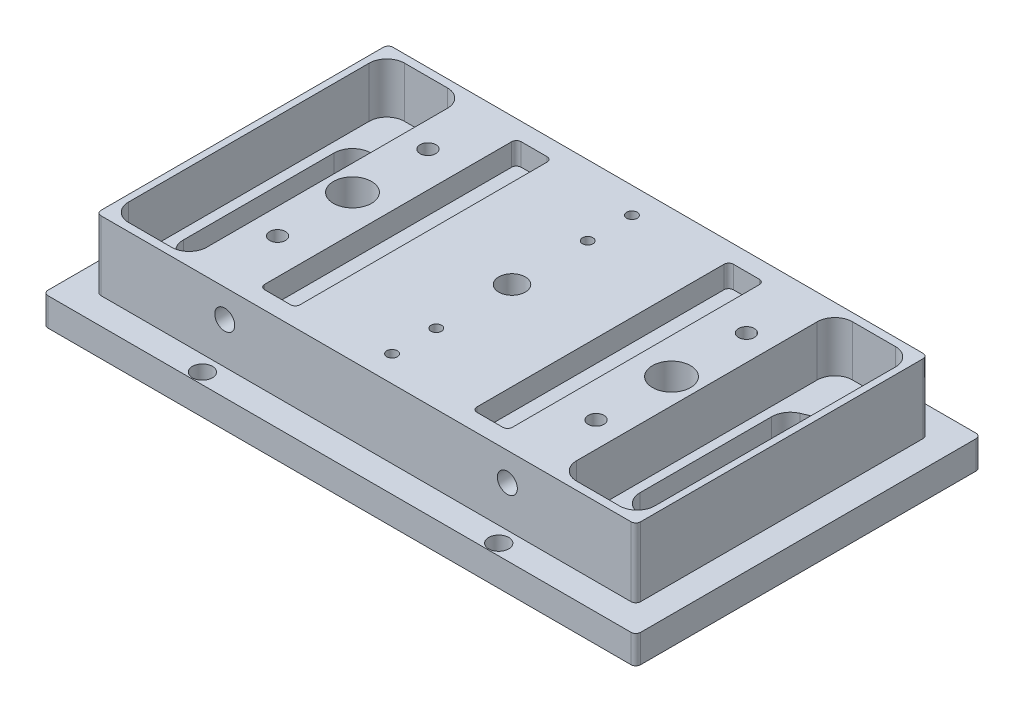
from build123d import *

# Parameters (mm, degrees)
MAIN_SKETCH_W                         = 67
MAIN_SKETCH_H                         = 39
MAIN_SKETCH_W_2                       = 61
MAIN_SKETCH_H_2                       = 33
LIP_DEPTH                             = 3.175
MOUNTING_BASE_OUTLINE_W               = 61
MOUNTING_BASE_OUTLINE_H               = 33
MOUNTING_BASE_OUTLINE_R               = 2.15265
MOUNTING_BASE_OUTLINE_R_2             = 1.5
MOUNTING_BASE_DEPTH                   = 11
HEATER_CART_4_40_TAPS_D               = 2.2606
HEATER_CART_4_40_TAPS_DEPTH           = 7.595
HEATER_CART_4_40_TAPS_TIP             = 0.679152758
HEATER_CART_4_40_TAPS_ON_FACE_2_D     = 2.2606
HEATER_CART_4_40_TAPS_ON_FACE_2_DEPTH = 7.595
HEATER_CART_4_40_TAPS_ON_FACE_2_TIP   = 0.679152758
CHIP_CLAMP_0_80_TAPS_AT_2_COUNT       = 2
CHIP_CLAMP_0_80_TAPS_AT_2_PITCH       = 5
CHIP_CLAMP_0_80_TAPS_AT_3_COUNT       = 2
CHIP_CLAMP_0_80_TAPS_AT_3_PITCH       = 22.1232
CHIP_CLAMP_0_80_TAPS_AT_4_COUNT       = 2
CHIP_CLAMP_0_80_TAPS_AT_4_PITCH       = 5
CHIP_CLAMP_0_80_TAPS_AT_5_COUNT       = 2
CHIP_CLAMP_0_80_TAPS_AT_5_PITCH       = 22.1232
CHIP_CLAMP_0_80_TAPS_AT_6_COUNT       = 2
CHIP_CLAMP_0_80_TAPS_AT_6_PITCH       = 27.1232
F_2_56_CLOSE_CLEAR_43_0_089_D         = 2.2606
PCB_2_56_TAPS_D                       = 1.778
PCB_2_56_TAPS_DEPTH                   = 5.734
PCB_2_56_TAPS_TIP                     = 0.53416509
MAIN_SKETCH_12_W                      = 8.85
MAIN_SKETCH_12_H                      = 31.2
BOTTOM_SQUARE_CUTOUT_DEPTH            = 2
SQUARE_MICRO_D_CUTOUT_START           = 5.3
SQUARE_MICRO_D_CUTOUT_OUTLINE_W       = 8.85
SQUARE_MICRO_D_CUTOUT_OUTLINE_H       = 31.2
SQUARE_MICRO_D_CUTOUT_DEPTH           = 5.7
MAIN_SKETCH_7_R                       = 0.285
ROUND_MICRO_D_CUTOUT_DEPTH            = 11
INTERNAL_CORNER_CUTOUTS_FILLET_R      = 2
BOTTOM_COVER_2_56_TAPS_D              = 1.778
BOTTOM_COVER_2_56_TAPS_DEPTH          = 5.734
BOTTOM_COVER_2_56_TAPS_TIP            = 0.53416509
F_2_56_TAPPED_HOLE1_D                 = 1.778
F_2_56_TAPPED_HOLE1_DEPTH             = 5.734
F_2_56_TAPPED_HOLE1_TIP               = 0.53416509
SKETCH20_W                            = 5.25
SKETCH20_H                            = 31
SKETCH20_W_2                          = 6
SKETCH20_H_2                          = 8.25
CUT_EXTRUDE3_DEPTH                    = 4
SKETCH23_W                            = 4
SKETCH23_H                            = 29
CUT_EXTRUDE4_DEPTH                    = 2.5
CUT_EXTRUDE7_START                    = -4
SKETCH20_3_W                          = 5.25
SKETCH20_3_H                          = 31
CUT_EXTRUDE7_DEPTH                    = 4
FILLET1_R                             = 0.54


# Read off the part's stored shape, not the designer's step: Mounting_Base, Square_Micro_D_Cutout
with BuildPart() as part:
    # Main_Sketch → Lip (new body)
    with BuildSketch(Plane(origin=(0, 0, 0), x_dir=(1, 0, 0), z_dir=(0, 1, 0))):
        with Locations((33.5, -19.5)):
            Rectangle(MAIN_SKETCH_W, MAIN_SKETCH_H)
        with Locations((33.5, -19.5)):
            Rectangle(MAIN_SKETCH_W_2, MAIN_SKETCH_H_2, mode=Mode.SUBTRACT)
    extrude(amount=LIP_DEPTH)

    # Mounting_Base outline → Mounting_Base (add)
    with BuildSketch(Plane(origin=(0, 0, 0), x_dir=(1, 0, 0), z_dir=(0, 1, 0))):
        with Locations((33.5, -19.5)):
            Rectangle(MOUNTING_BASE_OUTLINE_W, MOUNTING_BASE_OUTLINE_H)
        with Locations((15.466, -19.5)):
            Circle(MOUNTING_BASE_OUTLINE_R, mode=Mode.SUBTRACT)
        with Locations((33.5, -19.5)):
            Circle(MOUNTING_BASE_OUTLINE_R_2, mode=Mode.SUBTRACT)
        with Locations((51.534, -19.5)):
            Circle(MOUNTING_BASE_OUTLINE_R, mode=Mode.SUBTRACT)
    extrude(amount=MOUNTING_BASE_DEPTH)

    # Heater_Cart_#4-40_Taps
    with Locations(Plane(origin=(49.475, 7.825, 3), x_dir=(-1, 0, 0), z_dir=(0, 0, -1))):
        with Locations((0, 0), (31.95, 0)):
            Hole(HEATER_CART_4_40_TAPS_D / 2, depth=HEATER_CART_4_40_TAPS_DEPTH)
            with Locations((0, 0, -(HEATER_CART_4_40_TAPS_DEPTH + HEATER_CART_4_40_TAPS_TIP / 2))):  # 118° drill point
                Cone(0, HEATER_CART_4_40_TAPS_D / 2, HEATER_CART_4_40_TAPS_TIP, mode=Mode.SUBTRACT)

    # Heater_Cart_#4-40_Taps on face 2
    with Locations(Plane(origin=(17.525, 7.825, 36), x_dir=(1, 0, 0), z_dir=(0, 0, 1))):
        with Locations((0, 0), (31.95, 0)):
            Hole(HEATER_CART_4_40_TAPS_ON_FACE_2_D / 2, depth=HEATER_CART_4_40_TAPS_ON_FACE_2_DEPTH)
            with Locations((0, 0, -(HEATER_CART_4_40_TAPS_ON_FACE_2_DEPTH + HEATER_CART_4_40_TAPS_ON_FACE_2_TIP / 2))):  # 118° drill point
                Cone(0, HEATER_CART_4_40_TAPS_ON_FACE_2_D / 2, HEATER_CART_4_40_TAPS_ON_FACE_2_TIP, mode=Mode.SUBTRACT)

    # Sketch3 → Chip_Clamp_#0-80 Taps (revolve, cut)
    with BuildSketch(Plane(origin=(33.5, 11, 5.9384), x_dir=(0, 0, 1), z_dir=(1, 0, 0))):
        Polygon((0, 0), (0, 4.358890611), (0.59563, 4.001), (0.59563, 0), align=None)
    chip_clamp_0_80_taps = revolve(axis=Axis((33.5, 17.35, 5.9384), (0, -1, 0)), mode=Mode.SUBTRACT)

    # Chip_Clamp_#0-80 Taps at 2: Chip_Clamp_#0-80 Taps ×2
    with Locations(*[(0, 0, i * CHIP_CLAMP_0_80_TAPS_AT_2_PITCH) for i in range(1, CHIP_CLAMP_0_80_TAPS_AT_2_COUNT)]):
        add(chip_clamp_0_80_taps, mode=Mode.SUBTRACT)

    # Chip_Clamp_#0-80 Taps at 3: Chip_Clamp_#0-80 Taps ×2
    with Locations(*[(0, 0, i * CHIP_CLAMP_0_80_TAPS_AT_3_PITCH) for i in range(1, CHIP_CLAMP_0_80_TAPS_AT_3_COUNT)]):
        add(chip_clamp_0_80_taps, mode=Mode.SUBTRACT)

    # Chip_Clamp_#0-80 Taps at 4: Chip_Clamp_#0-80 Taps ×2
    with Locations(*[(0, 0, i * CHIP_CLAMP_0_80_TAPS_AT_4_PITCH) for i in range(1, CHIP_CLAMP_0_80_TAPS_AT_4_COUNT)]):
        add(chip_clamp_0_80_taps, mode=Mode.SUBTRACT)

    # Chip_Clamp_#0-80 Taps at 5: Chip_Clamp_#0-80 Taps ×2
    with Locations(*[(0, 0, i * CHIP_CLAMP_0_80_TAPS_AT_5_PITCH) for i in range(1, CHIP_CLAMP_0_80_TAPS_AT_5_COUNT)]):
        add(chip_clamp_0_80_taps, mode=Mode.SUBTRACT)

    # Chip_Clamp_#0-80 Taps at 6: Chip_Clamp_#0-80 Taps ×2
    with Locations(*[(0, 0, i * CHIP_CLAMP_0_80_TAPS_AT_6_PITCH) for i in range(1, CHIP_CLAMP_0_80_TAPS_AT_6_COUNT)]):
        add(chip_clamp_0_80_taps, mode=Mode.SUBTRACT)

    # 2-56_Close_Clear#43 (0.089) (through all)
    with Locations(Plane(origin=(16.75, 0, 37.75), x_dir=(0, 0, -1), z_dir=(0, -1, 0))):
        with Locations((0, 0), (36.5, 0), (36.5, 33.5), (0, 33.5)):
            Hole(F_2_56_CLOSE_CLEAR_43_0_089_D / 2)

    # PCB #2-56 Taps
    with Locations(Plane(origin=(15.5, 11, 11), x_dir=(0, 0, 1), z_dir=(0, 1, 0))):
        with Locations((0, 0), (17, 0), (0, 36), (17, 36)):
            Hole(PCB_2_56_TAPS_D / 2, depth=PCB_2_56_TAPS_DEPTH)
            with Locations((0, 0, -(PCB_2_56_TAPS_DEPTH + PCB_2_56_TAPS_TIP / 2))):  # 118° drill point
                Cone(0, PCB_2_56_TAPS_D / 2, PCB_2_56_TAPS_TIP, mode=Mode.SUBTRACT)

    # Main_Sketch<12> → Bottom_square_cutout (cut)
    with BuildSketch(Plane(origin=(0, 0, 0), x_dir=(1, 0, 0), z_dir=(0, 1, 0))):
        with Locations((8.175, -19.5)):
            Rectangle(MAIN_SKETCH_12_W, MAIN_SKETCH_12_H)
        with BuildLine():
            ThreePointArc((7.771574965, -29.946222286), (6.746212222, -30.101578951), (5.771946869, -29.746175702))
            ThreePointArc((5.771946869, -29.746175702), (5.101632057, -28.994424217), (4.859546604, -28.01675))
            Line((4.859546604, -28.01675), (4.859546604, -10.98325))
            ThreePointArc((4.859546604, -10.98325), (5.101632057, -10.005575783), (5.771946869, -9.253824298))
            ThreePointArc((5.771946869, -9.253824298), (6.746212222, -8.898421049), (7.771574965, -9.053777714))
            Line((7.771574965, -9.053777714), (10.304010046, -10.12581902))
            ThreePointArc((10.304010046, -10.12581902), (11.233840891, -10.898001292), (11.5824534, -12.055291306))
            Line((11.5824534, -12.055291306), (11.5824534, -26.944708694))
            ThreePointArc((11.5824534, -26.944708694), (11.233840891, -28.101998708), (10.304010046, -28.87418098))
            Line((10.304010046, -28.87418098), (7.771574965, -29.946222286))
        make_face(mode=Mode.SUBTRACT)
    bottom_square_cutout = extrude(amount=BOTTOM_SQUARE_CUTOUT_DEPTH, mode=Mode.SUBTRACT)

    # Square_Micro_D_Cutout outline → Square_Micro_D_Cutout (cut)
    with BuildSketch(Plane(origin=(0, 0, 0), x_dir=(1, 0, 0), z_dir=(0, 1, 0)).offset(SQUARE_MICRO_D_CUTOUT_START)):
        with Locations((8.175, -19.5)):
            Rectangle(SQUARE_MICRO_D_CUTOUT_OUTLINE_W, SQUARE_MICRO_D_CUTOUT_OUTLINE_H)
        with BuildLine():
            ThreePointArc((7.771574965, -29.946222286), (5.797492447, -29.763373348), (4.859546604, -28.01675))
            Line((4.859546604, -28.01675), (4.859546604, -10.98325))
            ThreePointArc((4.859546604, -10.98325), (5.797492447, -9.236626652), (7.771574965, -9.053777714))
            Line((7.771574965, -9.053777714), (10.304010046, -10.12581902))
            ThreePointArc((10.304010046, -10.12581902), (11.233840891, -10.898001291), (11.5824534, -12.055291306))
            Line((11.5824534, -12.055291306), (11.5824534, -26.944708694))
            ThreePointArc((11.5824534, -26.944708694), (11.233840891, -28.101998709), (10.304010046, -28.87418098))
            Line((10.304010046, -28.87418098), (7.771574965, -29.946222286))
        make_face(mode=Mode.SUBTRACT)
    square_micro_d_cutout = extrude(amount=SQUARE_MICRO_D_CUTOUT_DEPTH, mode=Mode.SUBTRACT)

    # Main_Sketch<7> → Round_Micro_D_Cutout (cut)
    # profile 1 of 2: a face of its own
    with BuildSketch(Plane(origin=(0, 0, 0), x_dir=(1, 0, 0), z_dir=(0, 1, 0))):
        with BuildLine():
            ThreePointArc((5.771946869, -29.746175702), (5.101632057, -28.994424217), (4.859546604, -28.01675))
            Line((4.859546604, -28.01675), (4.859546604, -10.98325))
            ThreePointArc((4.859546604, -10.98325), (5.101632057, -10.005575783), (5.771946869, -9.253824298))
            ThreePointArc((5.771946869, -9.253824298), (6.746212222, -8.898421049), (7.771574965, -9.053777714))
            Line((7.771574965, -9.053777714), (10.304010046, -10.12581902))
            ThreePointArc((10.304010046, -10.12581902), (11.233840891, -10.898001292), (11.5824534, -12.055291306))
            Line((11.5824534, -12.055291306), (11.5824534, -26.944708694))
            ThreePointArc((11.5824534, -26.944708694), (11.233840891, -28.101998708), (10.304010046, -28.87418098))
            Line((10.304010046, -28.87418098), (7.771574965, -29.946222286))
            ThreePointArc((7.771574965, -29.946222286), (6.746212222, -30.101578951), (5.771946869, -29.746175702))
        make_face()
        with Locations((7.649546604, -19.5)):
            Circle(MAIN_SKETCH_7_R, mode=Mode.SUBTRACT)
    # profile 2 of 2: a face of its own
    with BuildSketch(Plane(origin=(0, 0, 0), x_dir=(1, 0, 0), z_dir=(0, 1, 0))):
        with Locations((7.649546604, -19.5)):
            Circle(MAIN_SKETCH_7_R)
    round_micro_d_cutout = extrude(amount=ROUND_MICRO_D_CUTOUT_DEPTH, mode=Mode.SUBTRACT)

    # MicroD_Mirror: Bottom_square_cutout, Square_Micro_D_Cutout, Round_Micro_D_Cutout across plane
    add(bottom_square_cutout.mirror(Plane(origin=(33.5, 0, 0), x_dir=(0, 0, 1), z_dir=(1, 0, 0))), mode=Mode.SUBTRACT)
    add(square_micro_d_cutout.mirror(Plane(origin=(33.5, 0, 0), x_dir=(0, 0, 1), z_dir=(1, 0, 0))), mode=Mode.SUBTRACT)
    add(round_micro_d_cutout.mirror(Plane(origin=(33.5, 0, 0), x_dir=(0, 0, 1), z_dir=(1, 0, 0))), mode=Mode.SUBTRACT)

    # Internal_Corner_cutouts_fillet
    internal_corner_cutouts_fillet_edges = [part.edges().sort_by_distance(p)[0] for p in [
        (12.6, 1, 35.1),
        (12.6, 1, 3.9),
        (3.75, 1, 3.9),
        (3.75, 1, 35.1),
        (12.6, 8.15, 35.1),
        (3.75, 8.15, 35.1),
        (3.75, 8.15, 3.9),
        (12.6, 8.15, 3.9),
        (54.4, 1, 3.9),
        (54.4, 1, 35.1),
        (63.25, 1, 35.1),
        (63.25, 1, 3.9),
        (63.25, 8.15, 3.9),
        (63.25, 8.15, 35.1),
        (54.4, 8.15, 35.1),
        (54.4, 8.15, 3.9),
    ]]
    fillet(internal_corner_cutouts_fillet_edges, radius=INTERNAL_CORNER_CUTOUTS_FILLET_R)

    # Bottom_Cover#2-56 Taps
    with Locations(Plane(origin=(51.035, 0, 15.53149915), x_dir=(0, 0, -1), z_dir=(0, -1, 0))):
        with Locations((0, 0), (-8, 0), (-8, -36.07), (0, -36.07)):
            Hole(BOTTOM_COVER_2_56_TAPS_D / 2, depth=BOTTOM_COVER_2_56_TAPS_DEPTH)
            with Locations((0, 0, -(BOTTOM_COVER_2_56_TAPS_DEPTH + BOTTOM_COVER_2_56_TAPS_TIP / 2))):  # 118° drill point
                Cone(0, BOTTOM_COVER_2_56_TAPS_D / 2, BOTTOM_COVER_2_56_TAPS_TIP, mode=Mode.SUBTRACT)

    # #2-56 Tapped Hole1
    with Locations(Plane(origin=(29.69, 0, 25.88), x_dir=(0, 0, -1), z_dir=(0, -1, 0))):
        with Locations((0, 0), (-7.62, 0), (-7.62, 7.62), (0, 7.62)):
            Hole(F_2_56_TAPPED_HOLE1_D / 2, depth=F_2_56_TAPPED_HOLE1_DEPTH)
            with Locations((0, 0, -(F_2_56_TAPPED_HOLE1_DEPTH + F_2_56_TAPPED_HOLE1_TIP / 2))):  # 118° drill point
                Cone(0, F_2_56_TAPPED_HOLE1_D / 2, F_2_56_TAPPED_HOLE1_TIP, mode=Mode.SUBTRACT)

    # Sketch20 → Cut-Extrude3 (cut)
    with BuildSketch(Plane.XZ):
        with Locations((22.375, 19.5)):
            Rectangle(SKETCH20_W, SKETCH20_H)
        with Locations((16.75, 30.875)):
            Rectangle(SKETCH20_W_2, SKETCH20_H_2)
        with Locations((16.75, 8.125)):
            Rectangle(SKETCH20_W_2, SKETCH20_H_2)
        with Locations((44.625, 19.5)):
            Rectangle(SKETCH20_W, SKETCH20_H)
        with Locations((50.25, 8.125)):
            Rectangle(SKETCH20_W_2, SKETCH20_H_2)
        with Locations((50.25, 30.875)):
            Rectangle(SKETCH20_W_2, SKETCH20_H_2)
    extrude(amount=-CUT_EXTRUDE3_DEPTH, mode=Mode.SUBTRACT)

    # Sketch23 → Cut-Extrude4 (cut)
    with BuildSketch(Plane(origin=(0, 11, 0), x_dir=(1, 0, 0), z_dir=(0, 1, 0))):
        with Locations((21.5, -19.5)):
            Rectangle(SKETCH23_W, SKETCH23_H)
        with Locations((45.5, -19.5)):
            Rectangle(SKETCH23_W, SKETCH23_H)
    extrude(amount=-CUT_EXTRUDE4_DEPTH, mode=Mode.SUBTRACT)

    # Sketch20<3> → Cut-Extrude7 (cut)
    with BuildSketch(Plane.XZ.offset(CUT_EXTRUDE7_START)):
        with Locations((22.375, 19.5)):
            Rectangle(SKETCH20_3_W, SKETCH20_3_H)
        with Locations((44.625, 19.5)):
            Rectangle(SKETCH20_3_W, SKETCH20_3_H)
    extrude(amount=-CUT_EXTRUDE7_DEPTH, mode=Mode.SUBTRACT)

    # Fillet1
    fillet1_edges = [part.edges().sort_by_distance(p)[0] for p in [
        (67, 1.5875, 39),
        (0, 1.5875, 39),
        (0, 1.5875, 0),
        (67, 1.5875, 0),
        (64, 7.0875, 36),
        (64, 7.0875, 3),
        (3, 7.0875, 3),
        (3, 7.0875, 36),
        (25, 4, 4),
        (13.75, 2, 4),
        (13.75, 2, 12.25),
        (19.75, 2, 12.25),
        (19.75, 2, 26.75),
        (13.75, 2, 26.75),
        (13.75, 2, 35),
        (25, 4, 35),
        (42, 4, 4),
        (42, 4, 35),
        (53.25, 2, 35),
        (53.25, 2, 26.75),
        (53.25, 2, 12.25),
        (53.25, 2, 4),
        (19.5, 9.75, 34),
        (19.5, 9.75, 5),
        (23.5, 9.75, 5),
        (23.5, 9.75, 34),
        (43.5, 9.75, 34),
        (43.5, 9.75, 5),
        (47.5, 9.75, 5),
        (47.5, 9.75, 34),
        (19.75, 6, 35),
        (19.75, 6, 4),
        (47.25, 6, 35),
        (47.25, 6, 4),
    ]]
    fillet(fillet1_edges, radius=FILLET1_R)


solid = part.part
